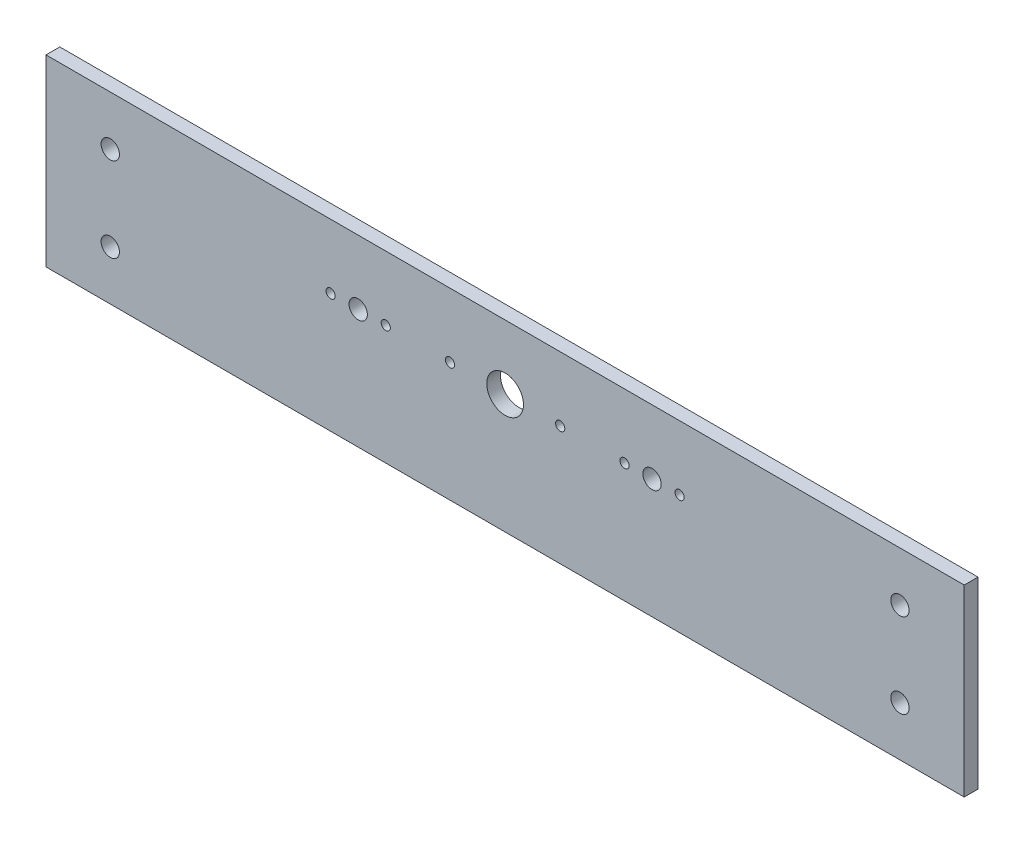
from build123d import *

# Parameters (mm, degrees)
SKETCH2_W           = 500
SKETCH2_H           = 100
BOSS_EXTRUDE1_DEPTH = 7.5
SKETCH9_R           = 5
SKETCH9_R_2         = 2.5
SKETCH9_R_3         = 10
CUT_EXTRUDE3_DEPTH  = 510.957106039
SKETCH11_R          = 5
CUT_EXTRUDE4_DEPTH  = 510.957106039


with BuildPart() as part:
    # Sketch2 → Boss-Extrude1 (new body)
    with BuildSketch(Plane.XY):
        with Locations((250, 50)):
            Rectangle(SKETCH2_W, SKETCH2_H)
    extrude(amount=BOSS_EXTRUDE1_DEPTH)

    # Sketch9 → Cut-Extrude3 (cut, through all)
    with BuildSketch(Plane.XY.offset(7.5)):
        with Locations((170, 65)):
            Circle(SKETCH9_R)
        with Locations((185, 65)):
            Circle(SKETCH9_R_2)
        with Locations((155, 65)):
            Circle(SKETCH9_R_2)
        with Locations((330, 65)):
            Circle(SKETCH9_R)
        with Locations((345, 65)):
            Circle(SKETCH9_R_2)
        with Locations((315, 65)):
            Circle(SKETCH9_R_2)
        with Locations((250, 65)):
            Circle(SKETCH9_R_3)
        with Locations((280, 65)):
            Circle(SKETCH9_R_2)
        with Locations((220, 65)):
            Circle(SKETCH9_R_2)
    extrude(amount=-CUT_EXTRUDE3_DEPTH, mode=Mode.SUBTRACT)

    # Sketch11 → Cut-Extrude4 (cut, through all)
    with BuildSketch(Plane.XY.offset(7.5)):
        with Locations((35, 73)):
            Circle(SKETCH11_R)
        with Locations((35, 27)):
            Circle(SKETCH11_R)
        with Locations((465, 27)):
            Circle(SKETCH11_R)
        with Locations((465, 73)):
            Circle(SKETCH11_R)
    extrude(amount=-CUT_EXTRUDE4_DEPTH, mode=Mode.SUBTRACT)


solid = part.part
